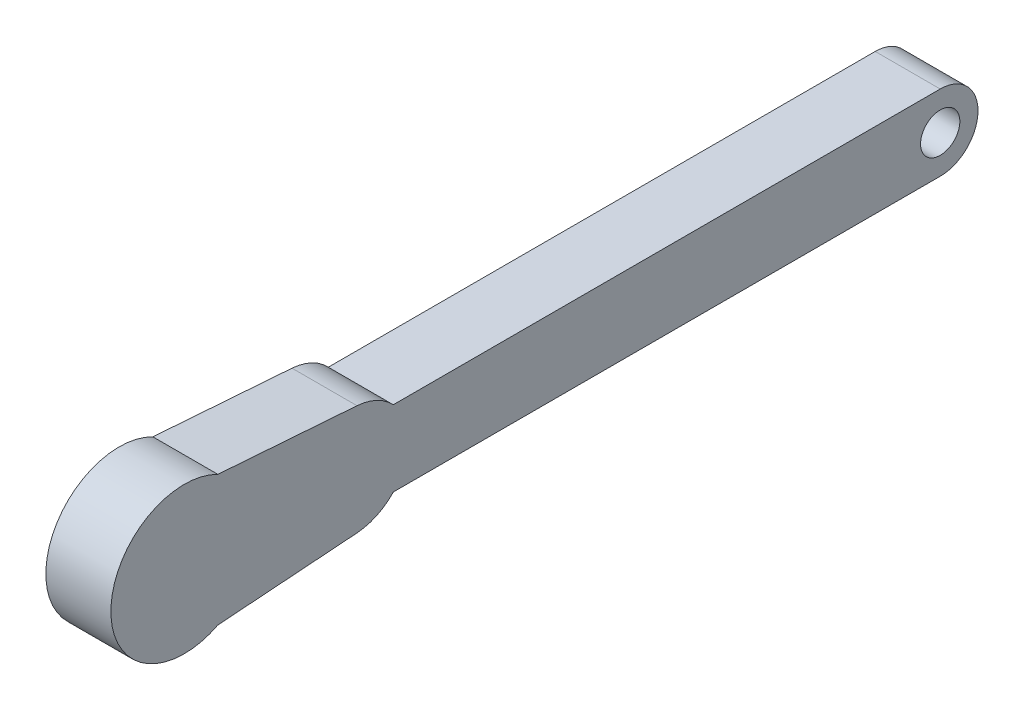
from build123d import *

# Parameters (mm, degrees)
SKETCH2_W                     = 5.461
SKETCH2_H                     = 71.755
BOSS_EXTRUDE1_DEPTH           = 3.175
BOSS_EXTRUDE2_DEPTH           = 5.461
CUT_EXTRUDE1_DEPTH            = 2.032
M3_CLEARANCE_HOLE_CLEARENCE_D = 3.3
FILLET1_R                     = 3.175
SKETCH19_R                    = 2
CUT_EXTRUDE2_DEPTH            = 0.500000016
CHAMFER1_SIZE                 = 0.500000016


with BuildPart() as part:
    # Sketch2 → Boss-Extrude1 (new, symmetric)
    with BuildSketch(Plane(origin=(0, 0, 0), x_dir=(1, 0, 0), z_dir=(0, 1, 0))):
        with Locations((0, 12.7)):
            Rectangle(SKETCH2_W, SKETCH2_H)
    extrude(amount=BOSS_EXTRUDE1_DEPTH, both=True)

    # Sketch7 → Boss-Extrude2 (add)
    with BuildSketch(Plane(origin=(-2.7305, 0, 0), x_dir=(0, -1, 0), z_dir=(-1, 0, 0))):
        with BuildLine():
            Line((5.480272256, 15.273700964), (4.627706382, 3.584959425))
            ThreePointArc((4.627706382, 3.584959425), (0, -0.7175), (-4.627706382, 3.584959425))
            Line((-4.627706382, 3.584959425), (-5.480272256, 15.273700964))
            ThreePointArc((-5.480272256, 15.273700964), (0, 24.2625), (5.480272256, 15.273700964))
        make_face()
    extrude(amount=-BOSS_EXTRUDE2_DEPTH)

    # Sketch10 → Cut-Extrude1 (cut)
    with BuildSketch(Plane(origin=(-2.7305, 0, 0), x_dir=(0, -1, 0), z_dir=(-1, 0, 0))):
        with BuildLine():
            Line((-3.114188808, 16.004814628), (-2.221099593, 3.760495073))
            ThreePointArc((-2.221099593, 3.760495073), (0, 1.6955), (2.221099593, 3.760495073))
            Line((2.221099593, 3.760495073), (3.114188808, 16.004814628))
            ThreePointArc((3.114188808, 16.004814628), (0, 21.8495), (-3.114188808, 16.004814628))
        make_face()
    extrude(amount=-CUT_EXTRUDE1_DEPTH, mode=Mode.SUBTRACT)

    # M3 Clearance Hole clearence (through all)
    with Locations(Plane.ZY.offset(2.7305)):
        with Locations((-45.4025, 0)):
            Hole(M3_CLEARANCE_HOLE_CLEARENCE_D / 2)

    # Fillet1
    fillet1_edges = [part.edges().sort_by_distance(p)[0] for p in [
        (0, -3.175, -48.5775),
        (0, 3.175, -48.5775),
    ]]
    fillet(fillet1_edges, radius=FILLET1_R - 0.0001)  # a hair under: the kernel refuses the full size

    # Sketch19 → Cut-Extrude2 (cut)
    with BuildSketch(Plane.ZY.offset(0.6985)):
        with Locations((18.0975, 0)):
            Circle(SKETCH19_R)
    extrude(amount=-CUT_EXTRUDE2_DEPTH, mode=Mode.SUBTRACT)

    # Chamfer1
    chamfer1_edges = [part.edges().sort_by_distance(p)[0] for p in [
        (-0.6985, 0, 16.0975),
    ]]
    chamfer(chamfer1_edges, length=CHAMFER1_SIZE - 0.0001)  # a hair under: the kernel refuses the full size


solid = part.part
